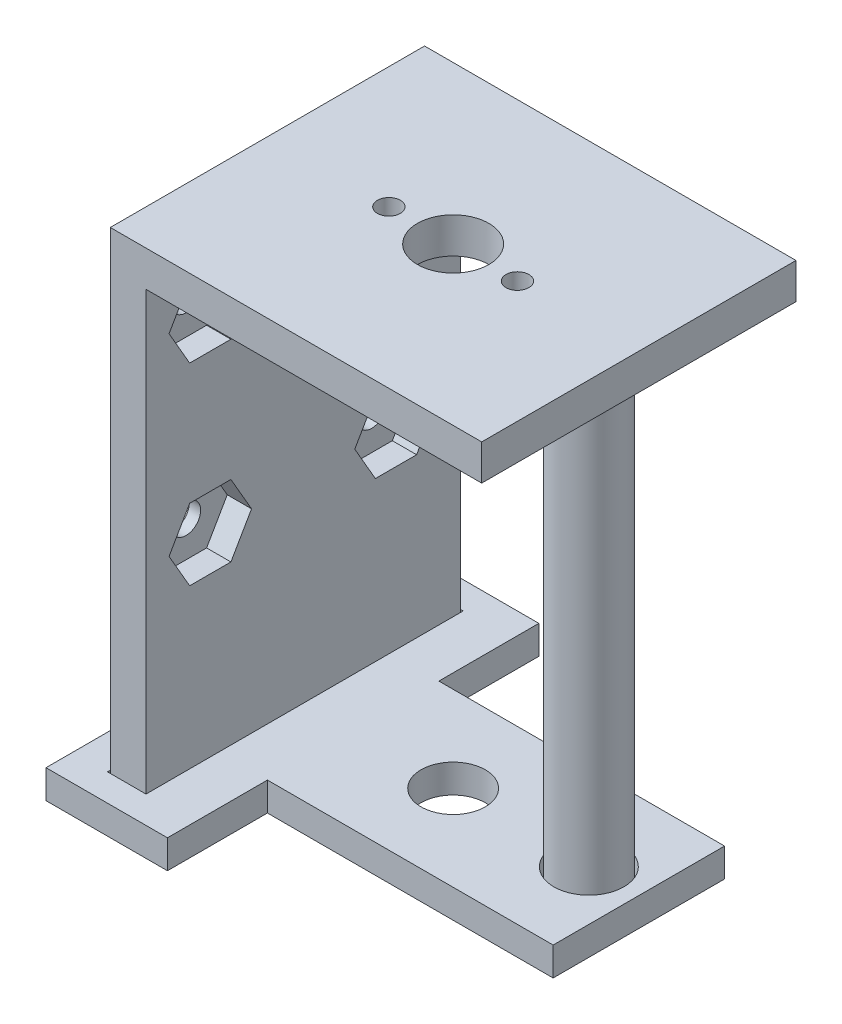
from build123d import *

# Parameters (mm, degrees)
EXTRUDE_THIN1_DEPTH          = 11
SKETCH6_R                    = 2.5
CUT_EXTRUDE1_DEPTH           = 39.923000912
BOSS_EXTRUDE1_START          = -78
SUPPORT_R                    = 2.25
BOSS_EXTRUDE1_DEPTH          = 32.5
SKETCH8_W                    = 28.5
SKETCH8_H                    = 26
BOSS_EXTRUDE2_DEPTH          = 2
SKETCH9_R                    = 2.45
CUT_EXTRUDE2_DEPTH           = 39.707234466
SKETCH11_W                   = 2.7
SKETCH11_H                   = 22.2
CUT_EXTRUDE3_DEPTH           = 41.425858061
M2_5_TAPPED_HOLE1_AT_2_COUNT = 2
M2_5_TAPPED_HOLE1_AT_2_PITCH = 13
M2_5_TAPPED_HOLE1_AT_3_COUNT = 2
M2_5_TAPPED_HOLE1_AT_3_PITCH = 18.741664814
M2_5_TAPPED_HOLE1_AT_4_COUNT = 2
M2_5_TAPPED_HOLE1_AT_4_PITCH = 13.5
SKETCH13_R                   = 2.25
CUT_EXTRUDE4_DEPTH           = 2
CUT_EXTRUDE5_DEPTH           = 41.425858061
M2_TAPPED_HOLE1_AT_2_COUNT   = 2
M2_TAPPED_HOLE1_AT_2_PITCH   = 9
CUT_EXTRUDE6_DEPTH           = 1.3
CUT_EXTRUDE7_DEPTH           = 1.7
SKETCH_PATTERN1_START        = -12.2
SKETCH_PATTERN1_OUTLINE_R    = 1.025
SKETCH_PATTERN1_DEPTH        = 1.7


# Read off the part's stored shape, not the designer's step: Sketch-Pattern1
with BuildPart() as part:
    # Arm → Extrude-Thin1 (new, symmetric)
    with BuildSketch(Plane.XY):
        Polygon((13, -43), (-13, -43), (-13, -78), (-10.5, -78), (-10.5, -45.5), (13, -45.5), align=None)
    extrude(amount=EXTRUDE_THIN1_DEPTH, both=True)

    # Sketch6 → Cut-Extrude1 (cut, through all)
    with BuildSketch(Plane(origin=(0, -43, 0), x_dir=(1, 0, 0), z_dir=(0, 1, 0))):
        with Locations(Location((0, 0, 0), (0, 0, 270))):
            Circle(SKETCH6_R)
    extrude(amount=-CUT_EXTRUDE1_DEPTH, mode=Mode.SUBTRACT)

    # Support (on Top Plane) → Boss-Extrude1 (add)
    with BuildSketch(Plane(origin=(0, 0, 0), x_dir=(1, 0, 0), z_dir=(0, 1, 0)).offset(BOSS_EXTRUDE1_START)):
        with Locations(Location((9.5, 0, 0), (0, 0, 270))):
            Circle(SUPPORT_R)
    extrude(amount=BOSS_EXTRUDE1_DEPTH)

    # Sketch16 → M2.5 Tapped Hole1 (revolve, cut)
    with BuildSketch(Plane(origin=(-13, -49, 6.5), x_dir=(0, 0, 1), z_dir=(0, 1, 0))):
        Polygon((0, 0), (0, 6.965882135), (1.025, 6.35), (1.025, 0), align=None)
    m2_5_tapped_hole1 = revolve(axis=Axis((-19.35, -49, 6.5), (1, 0, 0)), mode=Mode.SUBTRACT)

    # M2.5 Tapped Hole1 at 2: M2.5 Tapped Hole1 ×2
    with Locations(*[(0, 0, -i * M2_5_TAPPED_HOLE1_AT_2_PITCH) for i in range(1, M2_5_TAPPED_HOLE1_AT_2_COUNT)]):
        add(m2_5_tapped_hole1, mode=Mode.SUBTRACT)

    # M2.5 Tapped Hole1 at 3: M2.5 Tapped Hole1 ×2
    with Locations(*[Vector(0, -0.720320213491481, -0.6936416870658707) * (i * M2_5_TAPPED_HOLE1_AT_3_PITCH) for i in range(1, M2_5_TAPPED_HOLE1_AT_3_COUNT)]):
        add(m2_5_tapped_hole1, mode=Mode.SUBTRACT)

    # M2.5 Tapped Hole1 at 4: M2.5 Tapped Hole1 ×2
    with Locations(*[(0, -i * M2_5_TAPPED_HOLE1_AT_4_PITCH, 0) for i in range(1, M2_5_TAPPED_HOLE1_AT_4_COUNT)]):
        add(m2_5_tapped_hole1, mode=Mode.SUBTRACT)

    # Sketch20 → M2 Tapped Hole1 (revolve, cut)
    with BuildSketch(Plane(origin=(4.5, -43, 0), x_dir=(0, 0, 1), z_dir=(1, 0, 0))):
        Polygon((0, 0), (0, 2.980688495), (0.8, 2.5), (0.8, 0), align=None)
    m2_tapped_hole1 = revolve(axis=Axis((4.5, -36.65, 0), (0, -1, 0)), mode=Mode.SUBTRACT)

    # M2 Tapped Hole1 at 2: M2 Tapped Hole1 ×2
    with Locations(*[(-i * M2_TAPPED_HOLE1_AT_2_PITCH, 0, 0) for i in range(1, M2_TAPPED_HOLE1_AT_2_COUNT)]):
        add(m2_tapped_hole1, mode=Mode.SUBTRACT)

    # Sketch21 → Cut-Extrude6 (cut)
    with BuildSketch(Plane.XZ.offset(45.5)):
        Polygon((-3.576239569, 1.6), (-5.423760431, 1.6), (-6.347520861, 0), (-5.423760431, -1.6), (-3.576239569, -1.6), (-2.652479139, 0), align=None)
    cut_extrude6 = extrude(amount=-CUT_EXTRUDE6_DEPTH, mode=Mode.SUBTRACT)

    # Mirror2: Cut-Extrude6 across plane
    add(cut_extrude6.mirror(Plane(origin=(0, 0, 0), x_dir=(0, 0, 1), z_dir=(1, 0, 0))), mode=Mode.SUBTRACT)

    # Sketch22 → Cut-Extrude7 (cut)
    with BuildSketch(Plane(origin=(-10.5, 0, 0), x_dir=(0, 0, -1), z_dir=(1, 0, 0))):
        Polygon((-5.056624327, -51.5), (-3.613248654, -49), (-5.056624327, -46.5), (-7.943375673, -46.5), (-9.386751346, -49), (-7.943375673, -51.5), align=None)
    extrude(amount=-CUT_EXTRUDE7_DEPTH, mode=Mode.SUBTRACT)

    # Sketch-Pattern1 outline → Sketch-Pattern1 (cut)
    # profile 1 of 3: a face of its own
    with BuildSketch(Plane.YZ.offset(SKETCH_PATTERN1_START)):
        Polygon((-49, -3.613248654), (-51.5, -5.056624327), (-51.5, -7.943375673), (-49, -9.386751346), (-46.5, -7.943375673), (-46.5, -5.056624327), align=None)
        with Locations((-49, -6.5)):
            Circle(SKETCH_PATTERN1_OUTLINE_R, mode=Mode.SUBTRACT)
    # profile 2 of 3: a face of its own
    with BuildSketch(Plane.YZ.offset(SKETCH_PATTERN1_START)):
        Polygon((-62.5, -3.613248654), (-65, -5.056624327), (-65, -7.943375673), (-62.5, -9.386751346), (-60, -7.943375673), (-60, -5.056624327), align=None)
        with Locations((-62.5, -6.5)):
            Circle(SKETCH_PATTERN1_OUTLINE_R, mode=Mode.SUBTRACT)
    # profile 3 of 3: a face of its own
    with BuildSketch(Plane.YZ.offset(SKETCH_PATTERN1_START)):
        Polygon((-62.5, 9.386751346), (-65, 7.943375673), (-65, 5.056624327), (-62.5, 3.613248654), (-60, 5.056624327), (-60, 7.943375673), align=None)
        with Locations((-62.5, 6.5)):
            Circle(SKETCH_PATTERN1_OUTLINE_R, mode=Mode.SUBTRACT)
    extrude(amount=SKETCH_PATTERN1_DEPTH, mode=Mode.SUBTRACT)


with BuildPart() as body_2:
    # Sketch8 → Boss-Extrude2 (new body)
    with BuildSketch(Plane(origin=(0, -78, 0), x_dir=(1, 0, 0), z_dir=(0, 1, 0))):
        with Locations((-1.25, 0)):
            Rectangle(SKETCH8_W, SKETCH8_H)
    extrude(amount=BOSS_EXTRUDE2_DEPTH)

    # Sketch9 → Cut-Extrude2 (cut, through all)
    with BuildSketch(Plane(origin=(0, -76, 0), x_dir=(1, 0, 0), z_dir=(0, 1, 0))):
        with Locations(Location((9.5, 0, 0), (0, 0, 270))):
            Circle(SKETCH9_R)
    extrude(amount=-CUT_EXTRUDE2_DEPTH, mode=Mode.SUBTRACT)

    # Sketch11 → Cut-Extrude3 (cut, through all)
    with BuildSketch(Plane(origin=(0, -78, 0), x_dir=(1, 0, 0), z_dir=(0, 1, 0))):
        with Locations((-11.75, 0)):
            Rectangle(SKETCH11_W, SKETCH11_H)
    extrude(amount=CUT_EXTRUDE3_DEPTH, mode=Mode.SUBTRACT)

    # Sketch13 → Cut-Extrude4 (cut)
    with BuildSketch(Plane(origin=(0, -78, 0), x_dir=(1, 0, 0), z_dir=(0, 1, 0))):
        with Locations(Location((0, 0, 0), (0, 0, 90))):
            Circle(SKETCH13_R)
    extrude(amount=CUT_EXTRUDE4_DEPTH, mode=Mode.SUBTRACT)

    # Sketch17 → Cut-Extrude5 (cut, symmetric)
    with BuildSketch(Plane(origin=(0, -78, 0), x_dir=(1, 0, 0), z_dir=(0, 1, 0))):
        Polygon((-7, 91.505474234), (-7, 13), (-7, 6), (13, 6), (91.505474234, 6), (194.428862648, 124.571556691), (95.923388414, 210.077030925), align=None)
    cut_extrude5 = extrude(amount=CUT_EXTRUDE5_DEPTH, both=True, mode=Mode.SUBTRACT)

    # Mirror1: Cut-Extrude5 across plane
    add(cut_extrude5.mirror(Plane.XY), mode=Mode.SUBTRACT)


solid = Compound([part.part, body_2.part])
